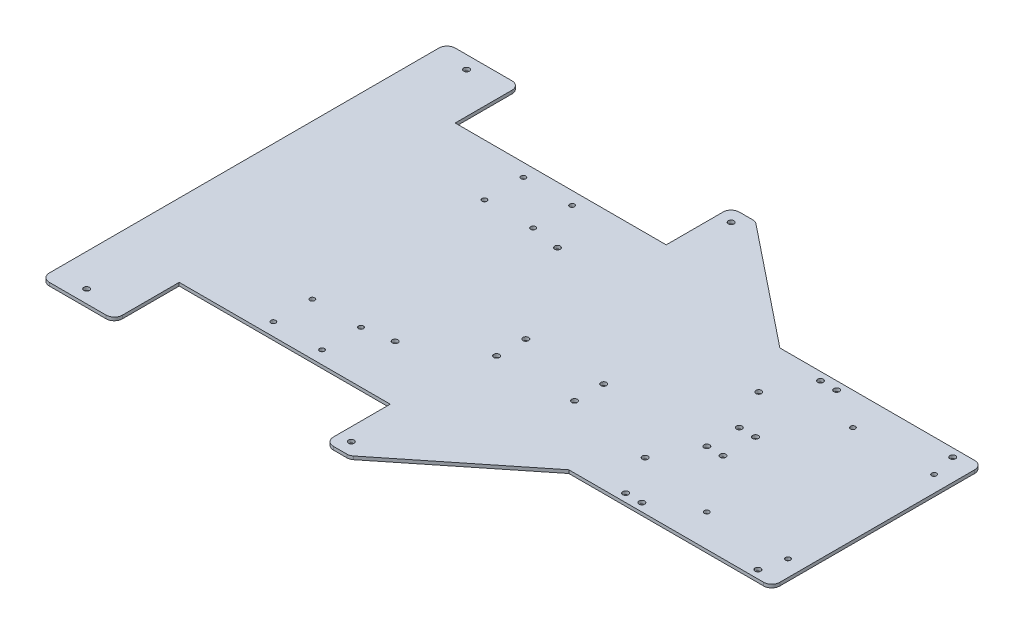
from build123d import *

# Parameters (mm, degrees)
SKETCH_1_W          = 390
SKETCH_1_H          = 250
EXTRUDE_1_DEPTH     = 2
SKETCH_2_W          = 130
SKETCH_2_H          = 40
SKETCH_2_W_2        = 125
SKETCH_2_H_2        = 60
CUT_EXTRUDE_1_DEPTH = 5
CUT_EXTRUDE_2_DEPTH = 10
FILLET_1_R          = 5
SKETCH_4_R          = 1.5
SKETCH_4_R_2        = 1.75
CUT_EXTRUDE_3_DEPTH = 232.633330935
SKETCH_5_R          = 1.75
CUT_EXTRUDE_4_DEPTH = 232.633330935
SKETCH_6_R          = 1.5
CUT_EXTRUDE_5_DEPTH = 232.633330935
SKETCH_7_R          = 1.75
CUT_EXTRUDE_6_DEPTH = 232.633330935


with BuildPart() as part:
    # 스케치1 → 보스-돌출1 (new body)
    with BuildSketch(Plane(origin=(0, 0, 0), x_dir=(1, 0, 0), z_dir=(0, 1, 0))):
        Rectangle(SKETCH_1_W, SKETCH_1_H)
    extrude(amount=EXTRUDE_1_DEPTH)

    # 스케치2 → 컷-돌출1 (cut)
    with BuildSketch(Plane(origin=(0, 2, 0), x_dir=(1, 0, 0), z_dir=(0, 1, 0))):
        with Locations((-85, 105)):
            Rectangle(SKETCH_2_W, SKETCH_2_H)
        with Locations((-85, -105)):
            Rectangle(SKETCH_2_W, SKETCH_2_H)
        with Locations((132.5, 95)):
            Rectangle(SKETCH_2_W_2, SKETCH_2_H_2)
        with Locations((132.5, -95)):
            Rectangle(SKETCH_2_W_2, SKETCH_2_H_2)
    extrude(amount=-CUT_EXTRUDE_1_DEPTH, mode=Mode.SUBTRACT)

    # 스케치3 → 컷-돌출2 (cut)
    with BuildSketch(Plane(origin=(0, 2, 0), x_dir=(1, 0, 0), z_dir=(0, 1, 0))):
        Polygon((-5, 125), (70, 65), (70, 125), align=None)
        Polygon((70, -65), (-5, -125), (70, -125), align=None)
    extrude(amount=-CUT_EXTRUDE_2_DEPTH, mode=Mode.SUBTRACT)

    # 필렛1
    fillet_1_edges = [part.edges().sort_by_distance(p)[0] for p in [
        (-20, 1, 125),
        (-20, 1, -125),
        (-5, 1, 125),
        (-5, 1, -125),
        (195, 1, -65),
        (195, 1, 65),
        (-195, 1, -125),
        (-195, 1, 125),
        (-150, 1, -125),
        (-150, 1, 125),
    ]]
    fillet(fillet_1_edges, radius=FILLET_1_R)

    # 스케치4 → 컷-돌출3 (cut, through all)
    with BuildSketch(Plane(origin=(0, 2, 0), x_dir=(1, 0, 0), z_dir=(0, 1, 0))):
        with Locations((-100, 77)):
            Circle(SKETCH_4_R)
        with Locations((-70, 77)):
            Circle(SKETCH_4_R)
        with Locations((-70, 53)):
            Circle(SKETCH_4_R)
        with Locations((-100, 53)):
            Circle(SKETCH_4_R)
        with Locations((-100, -53)):
            Circle(SKETCH_4_R)
        with Locations((-70, -53)):
            Circle(SKETCH_4_R)
        with Locations((-70, -77)):
            Circle(SKETCH_4_R)
        with Locations((-100, -77)):
            Circle(SKETCH_4_R)
        with Locations((100, 60)):
            Circle(SKETCH_4_R_2)
        with Locations((110, 60)):
            Circle(SKETCH_4_R_2)
        with Locations((100, 10)):
            Circle(SKETCH_4_R_2)
        with Locations((110, 10)):
            Circle(SKETCH_4_R_2)
        with Locations((100, -10)):
            Circle(SKETCH_4_R_2)
        with Locations((110, -10)):
            Circle(SKETCH_4_R_2)
        with Locations((100, -60)):
            Circle(SKETCH_4_R_2)
        with Locations((110, -60)):
            Circle(SKETCH_4_R_2)
    extrude(amount=-CUT_EXTRUDE_3_DEPTH, mode=Mode.SUBTRACT)

    # 스케치5 → 컷-돌출4 (cut, through all)
    with BuildSketch(Plane(origin=(0, 2, 0), x_dir=(1, 0, 0), z_dir=(0, 1, 0))):
        with Locations((-13, -8.5)):
            Circle(SKETCH_5_R)
        with Locations((35, -8.5)):
            Circle(SKETCH_5_R)
        with Locations((-13, -26.5)):
            Circle(SKETCH_5_R)
        with Locations((35, -26.5)):
            Circle(SKETCH_5_R)
    extrude(amount=-CUT_EXTRUDE_4_DEPTH, mode=Mode.SUBTRACT)

    # 스케치6 → 컷-돌출5 (cut, through all)
    with BuildSketch(Plane(origin=(0, 2, 0), x_dir=(1, 0, 0), z_dir=(0, 1, 0))):
        with Locations((135, 45)):
            Circle(SKETCH_6_R)
        with Locations((185, 45)):
            Circle(SKETCH_6_R)
        with Locations((135, -45)):
            Circle(SKETCH_6_R)
        with Locations((185, -45)):
            Circle(SKETCH_6_R)
    extrude(amount=-CUT_EXTRUDE_5_DEPTH, mode=Mode.SUBTRACT)

    # 스케치7 → 컷-돌출6 (cut, through all)
    with BuildSketch(Plane(origin=(0, 2, 0), x_dir=(1, 0, 0), z_dir=(0, 1, 0))):
        with Locations((-12, 117)):
            Circle(SKETCH_7_R)
        with Locations((-12, -117)):
            Circle(SKETCH_7_R)
        with Locations((181.5, 60)):
            Circle(SKETCH_7_R)
        with Locations((181.5, -60)):
            Circle(SKETCH_7_R)
        with Locations((-175, 117)):
            Circle(SKETCH_7_R)
        with Locations((-175, -117)):
            Circle(SKETCH_7_R)
        with Locations((87, 35)):
            Circle(SKETCH_7_R)
        with Locations((87, -35)):
            Circle(SKETCH_7_R)
        with Locations((-52, 50)):
            Circle(SKETCH_7_R)
        with Locations((-52, -50)):
            Circle(SKETCH_7_R)
    extrude(amount=-CUT_EXTRUDE_6_DEPTH, mode=Mode.SUBTRACT)


solid = part.part
